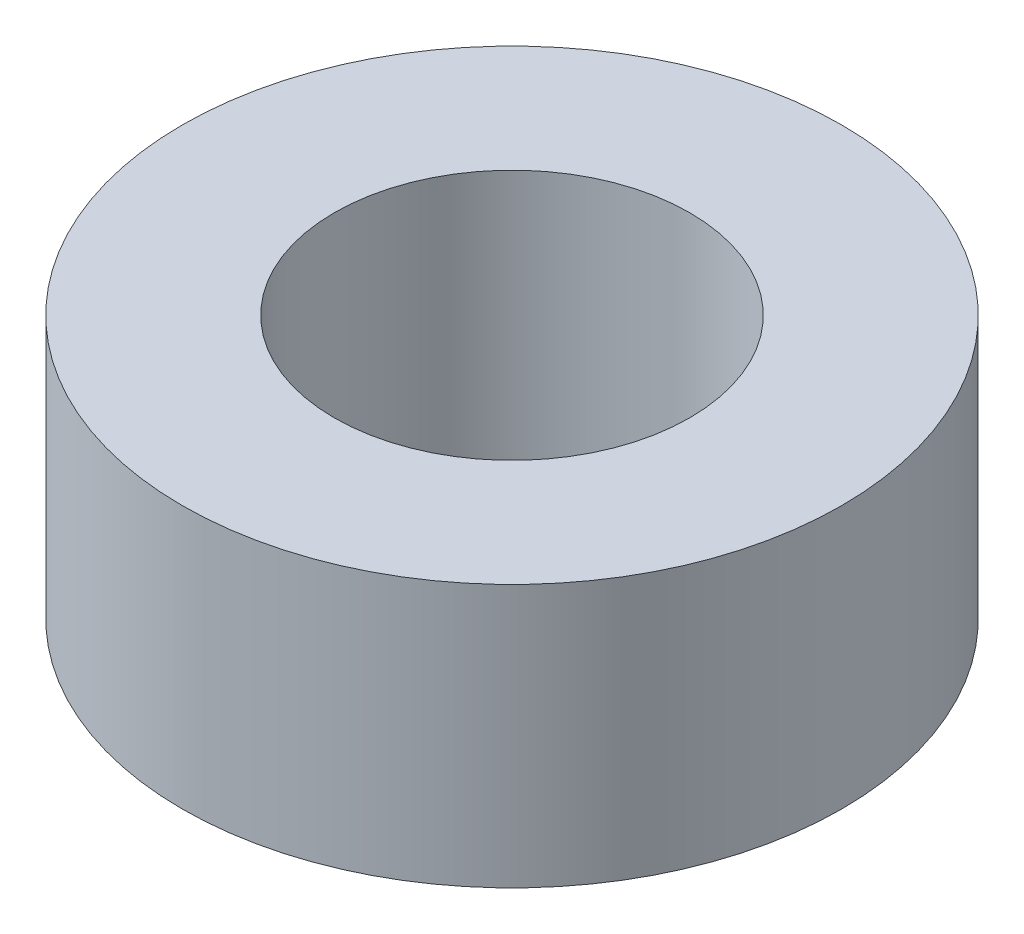
from build123d import *

# Parameters (mm, degrees)
SKETCH1_R           = 20
BOSS_EXTRUDE1_DEPTH = 15.941938315
SKETCH2_R           = 10.779895658
CUT_EXTRUDE1_DEPTH  = 33.467605351


with BuildPart() as part:
    # Sketch1 → Boss-Extrude1 (new body)
    with BuildSketch(Plane(origin=(0, 0, 0), x_dir=(1, 0, 0), z_dir=(0, 1, 0))):
        Circle(SKETCH1_R)
    extrude(amount=BOSS_EXTRUDE1_DEPTH)

    # Sketch2 → Cut-Extrude1 (cut, through all)
    with BuildSketch(Plane(origin=(0, 0, 0), x_dir=(1, 0, 0), z_dir=(0, 1, 0))):
        Circle(SKETCH2_R)
    extrude(amount=CUT_EXTRUDE1_DEPTH, mode=Mode.SUBTRACT)


solid = part.part
